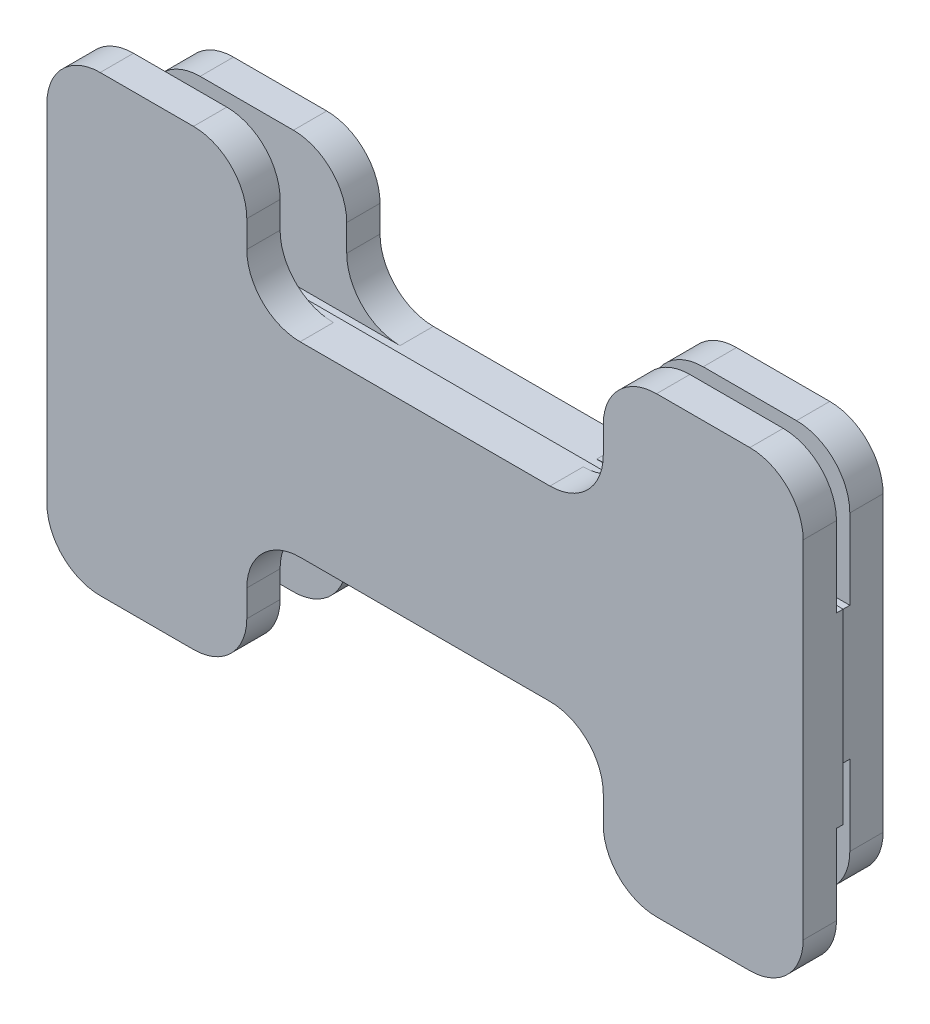
from build123d import *

# Parameters (mm, degrees)
SKETCH2_W            = 7
SKETCH2_H            = 12
BOSS_EXTRUDE1_DEPTH  = 12
SKETCH3_W            = 5
SKETCH3_H            = 8
CUT_EXTRUDE1_DEPTH   = 10
SKETCH4_W            = 3
SKETCH4_H            = 12
BOSS_EXTRUDE2_DEPTH  = 3.5
LPATTERN1_COUNT      = 8
LPATTERN1_PITCH      = 10.5
SKETCH5_W            = 9
SKETCH5_H            = 12
BOSS_EXTRUDE3_DEPTH  = 3.5
SKETCH6_W            = 12
SKETCH6_H            = 12
BOSS_EXTRUDE4_DEPTH  = 13.5
SKETCH7_W            = 12.5
SKETCH7_H            = 3
CUT_EXTRUDE2_DEPTH   = 3.5
SKETCH8_W            = 68.5
SKETCH8_H            = 3
CUT_EXTRUDE3_DEPTH   = 2
SKETCH11_W           = 105.5
SKETCH11_H           = 20
BOSS_EXTRUDE6_DEPTH  = 16
SPLIT1_START         = -4
SPLIT1_OUTLINE_W     = 105.5
SPLIT1_OUTLINE_H     = 4
SPLIT1_DEPTH         = 20
SPLIT1_START_2       = 2
SPLIT1_2_OUTLINE_W   = 5
SPLIT1_2_OUTLINE_H   = 10
SPLIT1_2_DEPTH       = 8
SPLIT1_START_3       = 4.5
SPLIT1_3_OUTLINE_W   = 5.5
SPLIT1_3_OUTLINE_H   = 2
SPLIT1_3_OUTLINE_W_2 = 12.5
SPLIT1_3_OUTLINE_H_2 = 3.5
SPLIT1_3_DEPTH       = 3
SPLIT1_START_4       = 12
SPLIT1_4_OUTLINE_W   = 105.5
SPLIT1_4_OUTLINE_H   = 20
SPLIT1_4_DEPTH       = 4
SPLIT1_5_OUTLINE_W   = 5
SPLIT1_5_OUTLINE_H   = 8
SPLIT1_5_DEPTH       = 10
SPLIT1_START_5       = 10
SPLIT1_6_OUTLINE_W   = 5.5
SPLIT1_6_OUTLINE_H   = 3
SPLIT1_6_DEPTH       = 2
SKETCH12_W           = 30
SKETCH12_H           = 5
BOSS_EXTRUDE7_DEPTH  = 20
SKETCH13_W           = 30
SKETCH13_H           = 5
BOSS_EXTRUDE8_DEPTH  = 20
FILLET1_R            = 8
SKETCH14_W           = 113.5
SKETCH14_H           = 28
SKETCH14_W_2         = 105.5
SKETCH14_H_2         = 20
BOSS_EXTRUDE9_DEPTH  = 6
SKETCH16_W           = 30
SKETCH16_H           = 5
BOSS_EXTRUDE10_DEPTH = 20
SKETCH17_W           = 30
SKETCH17_H           = 5
BOSS_EXTRUDE11_DEPTH = 20
FILLET2_R            = 8


# Read off the part's stored shape, not the designer's step: Split1
with BuildPart() as part:
    # Sketch2 → Boss-Extrude1 (new body)
    with BuildSketch(Plane.XY):
        with Locations((3.5, 6)):
            Rectangle(SKETCH2_W, SKETCH2_H)
    extrude(amount=BOSS_EXTRUDE1_DEPTH)

    # Sketch3 → Cut-Extrude1 (cut)
    with BuildSketch(Plane.XY.offset(12)):
        with Locations((3.5, 6)):
            Rectangle(SKETCH3_W, SKETCH3_H)
    extrude(amount=-CUT_EXTRUDE1_DEPTH, mode=Mode.SUBTRACT)

    # Sketch4 → Boss-Extrude2 (add)
    with BuildSketch(Plane(origin=(7, 0, 0), x_dir=(0, 0, -1), z_dir=(1, 0, 0))):
        with Locations((-10.5, 6)):
            Rectangle(SKETCH4_W, SKETCH4_H)
    extrude(amount=BOSS_EXTRUDE2_DEPTH)


with BuildPart() as lpattern1_1:
    # LPattern1: pattern copy
    add(part.part.moved(Location(Vector(1, 0, 0) * (1 * LPATTERN1_PITCH))))


with BuildPart() as lpattern1_2:
    # LPattern1: pattern copy
    add(part.part.moved(Location(Vector(1, 0, 0) * (2 * LPATTERN1_PITCH))))


with BuildPart() as lpattern1_3:
    # LPattern1: pattern copy
    add(part.part.moved(Location(Vector(1, 0, 0) * (3 * LPATTERN1_PITCH))))


with BuildPart() as lpattern1_4:
    # LPattern1: pattern copy
    add(part.part.moved(Location(Vector(1, 0, 0) * (4 * LPATTERN1_PITCH))))


with BuildPart() as lpattern1_5:
    # LPattern1: pattern copy
    add(part.part.moved(Location(Vector(1, 0, 0) * (5 * LPATTERN1_PITCH))))


with BuildPart() as lpattern1_6:
    # LPattern1: pattern copy
    add(part.part.moved(Location(Vector(1, 0, 0) * (6 * LPATTERN1_PITCH))))


with BuildPart() as lpattern1_7:
    # LPattern1: pattern copy
    add(part.part.moved(Location(Vector(1, 0, 0) * (7 * LPATTERN1_PITCH))))

    # Combine2: union LPattern1_4, LPattern1_1, part, LPattern1_6, LPattern1_3, LPattern1_5, LPattern1_2
    add(lpattern1_4.part)
    add(lpattern1_1.part)
    add(part.part)
    add(lpattern1_6.part)
    add(lpattern1_3.part)
    add(lpattern1_5.part)
    add(lpattern1_2.part)

    # Sketch5 → Boss-Extrude3 (add)
    with BuildSketch(Plane(origin=(80.5, 0, 0), x_dir=(0, 0, -1), z_dir=(1, 0, 0))):
        with Locations((-4.5, 6)):
            Rectangle(SKETCH5_W, SKETCH5_H)
    extrude(amount=BOSS_EXTRUDE3_DEPTH)

    # Sketch6 → Boss-Extrude4 (add)
    with BuildSketch(Plane.ZY):
        with Locations((6, 6)):
            Rectangle(SKETCH6_W, SKETCH6_H)
    extrude(amount=BOSS_EXTRUDE4_DEPTH)

    # Sketch7 → Cut-Extrude2 (cut)
    with BuildSketch(Plane.XY.offset(12)):
        with Locations((-5.25, 6)):
            Rectangle(SKETCH7_W, SKETCH7_H)
    extrude(amount=-CUT_EXTRUDE2_DEPTH, mode=Mode.SUBTRACT)

    # Sketch8 → Cut-Extrude3 (cut)
    with BuildSketch(Plane.XY.offset(12)):
        with Locations((40.25, 6)):
            Rectangle(SKETCH8_W, SKETCH8_H)
    extrude(amount=-CUT_EXTRUDE3_DEPTH, mode=Mode.SUBTRACT)


with BuildPart() as body_2:
    # Sketch11 → Boss-Extrude6 (new body)
    with BuildSketch(Plane(origin=(0, 0, 0), x_dir=(-1, 0, 0), z_dir=(0, 0, -1))):
        with Locations((-35.25, 6)):
            Rectangle(SKETCH11_W, SKETCH11_H)
    extrude(amount=-BOSS_EXTRUDE6_DEPTH)

    # Combine3: cut LPattern1_7
    add(lpattern1_7.part, mode=Mode.SUBTRACT)

    # Split1 4 outline → Split1 4 (cut)
    with BuildSketch(Plane.XY.offset(SPLIT1_START_4)):
        with Locations((35.25, 6)):
            Rectangle(SPLIT1_4_OUTLINE_W, SPLIT1_4_OUTLINE_H)
    extrude(amount=SPLIT1_4_DEPTH, mode=Mode.SUBTRACT)

    # Split1 5 outline → Split1 5 (cut)
    with BuildSketch(Plane.XY.offset(SPLIT1_START_2)):
        with Locations((77, 6)):
            Rectangle(SPLIT1_5_OUTLINE_W, SPLIT1_5_OUTLINE_H)
        with Locations((66.5, 6)):
            Rectangle(SPLIT1_5_OUTLINE_W, SPLIT1_5_OUTLINE_H)
        with Locations((56, 6)):
            Rectangle(SPLIT1_5_OUTLINE_W, SPLIT1_5_OUTLINE_H)
        with Locations((45.5, 6)):
            Rectangle(SPLIT1_5_OUTLINE_W, SPLIT1_5_OUTLINE_H)
        with Locations((35, 6)):
            Rectangle(SPLIT1_5_OUTLINE_W, SPLIT1_5_OUTLINE_H)
        with Locations((24.5, 6)):
            Rectangle(SPLIT1_5_OUTLINE_W, SPLIT1_5_OUTLINE_H)
        with Locations((14, 6)):
            Rectangle(SPLIT1_5_OUTLINE_W, SPLIT1_5_OUTLINE_H)
        Polygon((6, 10), (1, 10), (1, 7.5), (-11.5, 7.5), (-11.5, 4.5), (1, 4.5), (1, 2), (6, 2), align=None)
    extrude(amount=SPLIT1_5_DEPTH, mode=Mode.SUBTRACT)

    # Split1 6 outline → Split1 6 (cut)
    with BuildSketch(Plane.XY.offset(SPLIT1_START_5)):
        with Locations((71.75, 6)):
            Rectangle(SPLIT1_6_OUTLINE_W, SPLIT1_6_OUTLINE_H)
        with Locations((61.25, 6)):
            Rectangle(SPLIT1_6_OUTLINE_W, SPLIT1_6_OUTLINE_H)
        with Locations((50.75, 6)):
            Rectangle(SPLIT1_6_OUTLINE_W, SPLIT1_6_OUTLINE_H)
        with Locations((40.25, 6)):
            Rectangle(SPLIT1_6_OUTLINE_W, SPLIT1_6_OUTLINE_H)
        with Locations((29.75, 6)):
            Rectangle(SPLIT1_6_OUTLINE_W, SPLIT1_6_OUTLINE_H)
        with Locations((19.25, 6)):
            Rectangle(SPLIT1_6_OUTLINE_W, SPLIT1_6_OUTLINE_H)
        with Locations((8.75, 6)):
            Rectangle(SPLIT1_6_OUTLINE_W, SPLIT1_6_OUTLINE_H)
    extrude(amount=SPLIT1_6_DEPTH, mode=Mode.SUBTRACT)

    # Sketch12 → Boss-Extrude7 (add)
    with BuildSketch(Plane(origin=(0, 16, 0), x_dir=(1, 0, 0), z_dir=(0, 1, 0))):
        with Locations((-2.5, -2.5)):
            Rectangle(SKETCH12_W, SKETCH12_H)
        with Locations((73, -2.5)):
            Rectangle(SKETCH12_W, SKETCH12_H)
    extrude(amount=BOSS_EXTRUDE7_DEPTH)

    # Sketch13 → Boss-Extrude8 (add)
    with BuildSketch(Plane.XZ.offset(4)):
        with Locations((73, 2.5)):
            Rectangle(SKETCH13_W, SKETCH13_H)
        with Locations((-2.5, 2.5)):
            Rectangle(SKETCH13_W, SKETCH13_H)
    extrude(amount=BOSS_EXTRUDE8_DEPTH)

    # Fillet1
    fillet1_edges = [body_2.edges().sort_by_distance(p)[0] for p in [
        (58, 16, 2.5),
        (58, 36, 2.5),
        (88, 36, 2.5),
        (58, -4, 2.5),
        (88, -24, 2.5),
        (58, -24, 2.5),
        (12.5, -4, 2.5),
        (12.5, -24, 2.5),
        (-17.5, -24, 2.5),
        (12.5, 16, 2.5),
        (-17.5, 36, 2.5),
        (12.5, 36, 2.5),
    ]]
    fillet(fillet1_edges, radius=FILLET1_R)


with BuildPart() as body_2_2:
    # Split1 outline → Split1 (new body)
    with BuildSketch(Plane(origin=(0, 0, 0), x_dir=(1, 0, 0), z_dir=(0, 1, 0)).offset(SPLIT1_START)):
        with Locations((35.25, -14)):
            Rectangle(SPLIT1_OUTLINE_W, SPLIT1_OUTLINE_H)
    extrude(amount=SPLIT1_DEPTH)

    # Split1 2 outline → Split1 2 (add)
    with BuildSketch(Plane(origin=(0, 0, 0), x_dir=(1, 0, 0), z_dir=(0, 1, 0)).offset(SPLIT1_START_2)):
        with Locations((77, -7)):
            Rectangle(SPLIT1_2_OUTLINE_W, SPLIT1_2_OUTLINE_H)
        with Locations((66.5, -7)):
            Rectangle(SPLIT1_2_OUTLINE_W, SPLIT1_2_OUTLINE_H)
        with Locations((56, -7)):
            Rectangle(SPLIT1_2_OUTLINE_W, SPLIT1_2_OUTLINE_H)
        with Locations((3.5, -7)):
            Rectangle(SPLIT1_2_OUTLINE_W, SPLIT1_2_OUTLINE_H)
        with Locations((45.5, -7)):
            Rectangle(SPLIT1_2_OUTLINE_W, SPLIT1_2_OUTLINE_H)
        with Locations((14, -7)):
            Rectangle(SPLIT1_2_OUTLINE_W, SPLIT1_2_OUTLINE_H)
        with Locations((35, -7)):
            Rectangle(SPLIT1_2_OUTLINE_W, SPLIT1_2_OUTLINE_H)
        with Locations((24.5, -7)):
            Rectangle(SPLIT1_2_OUTLINE_W, SPLIT1_2_OUTLINE_H)
    extrude(amount=SPLIT1_2_DEPTH)

    # Split1 3 outline → Split1 3 (add)
    with BuildSketch(Plane(origin=(0, 0, 0), x_dir=(1, 0, 0), z_dir=(0, 1, 0)).offset(SPLIT1_START_3)):
        with Locations((71.75, -11)):
            Rectangle(SPLIT1_3_OUTLINE_W, SPLIT1_3_OUTLINE_H)
        with Locations((61.25, -11)):
            Rectangle(SPLIT1_3_OUTLINE_W, SPLIT1_3_OUTLINE_H)
        with Locations((-5.25, -10.25)):
            Rectangle(SPLIT1_3_OUTLINE_W_2, SPLIT1_3_OUTLINE_H_2)
        with Locations((50.75, -11)):
            Rectangle(SPLIT1_3_OUTLINE_W, SPLIT1_3_OUTLINE_H)
        with Locations((8.75, -11)):
            Rectangle(SPLIT1_3_OUTLINE_W, SPLIT1_3_OUTLINE_H)
        with Locations((40.25, -11)):
            Rectangle(SPLIT1_3_OUTLINE_W, SPLIT1_3_OUTLINE_H)
        with Locations((19.25, -11)):
            Rectangle(SPLIT1_3_OUTLINE_W, SPLIT1_3_OUTLINE_H)
        with Locations((29.75, -11)):
            Rectangle(SPLIT1_3_OUTLINE_W, SPLIT1_3_OUTLINE_H)
    extrude(amount=SPLIT1_3_DEPTH)

    # Sketch14 → Boss-Extrude9 (add)
    with BuildSketch(Plane.XY.offset(16)):
        with Locations((35.25, 6)):
            Rectangle(SKETCH14_W, SKETCH14_H)
        with Locations((35.25, 6)):
            Rectangle(SKETCH14_W_2, SKETCH14_H_2, mode=Mode.SUBTRACT)
    extrude(amount=-BOSS_EXTRUDE9_DEPTH)

    # Sketch16 → Boss-Extrude10 (add)
    with BuildSketch(Plane.XZ.offset(8)):
        with Locations((-6.5, 13.5)):
            Rectangle(SKETCH16_W, SKETCH16_H)
        with Locations((77, 13.5)):
            Rectangle(SKETCH16_W, SKETCH16_H)
    extrude(amount=BOSS_EXTRUDE10_DEPTH)

    # Sketch17 → Boss-Extrude11 (add)
    with BuildSketch(Plane(origin=(0, 20, 0), x_dir=(1, 0, 0), z_dir=(0, 1, 0))):
        with Locations((77, -13.5)):
            Rectangle(SKETCH17_W, SKETCH17_H)
        with Locations((-6.5, -13.5)):
            Rectangle(SKETCH17_W, SKETCH17_H)
    extrude(amount=BOSS_EXTRUDE11_DEPTH)

    # Fillet2
    fillet2_edges = [body_2_2.edges().sort_by_distance(p)[0] for p in [
        (62, -8, 13.5),
        (92, -28, 13.5),
        (62, -28, 13.5),
        (8.5, -8, 13.5),
        (-21.5, -28, 13.5),
        (8.5, -28, 13.5),
        (8.5, 20, 13.5),
        (-21.5, 40, 13.5),
        (8.5, 40, 13.5),
        (62, 20, 13.5),
        (92, 40, 13.5),
        (62, 40, 13.5),
    ]]
    fillet(fillet2_edges, radius=FILLET2_R)


solid = Compound([body_2.part, body_2_2.part])
